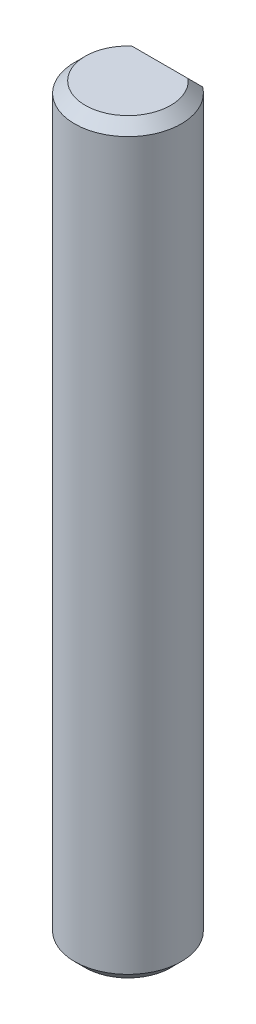
from build123d import *

# Parameters (mm, degrees)
SKETCH1_R           = 2.5
BOSS_EXTRUDE1_DEPTH = 17.5
CUT_EXTRUDE1_START  = -2
SKETCH3_W           = 5.788329994
SKETCH3_H           = 11.481307843
CUT_EXTRUDE1_DEPTH  = 35
CHAMFER1_SIZE       = 0.5


with BuildPart() as part:
    # Sketch1 → Boss-Extrude1 (new, symmetric)
    with BuildSketch(Plane(origin=(0, 0, 0), x_dir=(1, 0, 0), z_dir=(0, 1, 0))):
        with Locations(Location((0, 0, 0), (0, 0, 270))):
            Circle(SKETCH1_R)
    extrude(amount=BOSS_EXTRUDE1_DEPTH, both=True)

    # Sketch3 → Cut-Extrude1 (cut)
    with BuildSketch(Plane.XY.offset(CUT_EXTRUDE1_START)):
        with Locations((0, 13.740653921)):
            Rectangle(SKETCH3_W, SKETCH3_H)
        with Locations((0, -13.740653921)):
            Rectangle(SKETCH3_W, SKETCH3_H)
    extrude(amount=-CUT_EXTRUDE1_DEPTH, mode=Mode.SUBTRACT)

    # Chamfer1
    chamfer1_edges = [part.edges().sort_by_distance(p)[0] for p in [
        (-2.371708245, -17.5, 0.790569415),
        (0, -17.5, -2),
        (-2.371708245, 17.5, 0.790569415),
        (0, 17.5, -2),
    ]]
    chamfer(chamfer1_edges, length=CHAMFER1_SIZE - 0.0001)  # a hair under: the kernel refuses the full size


solid = part.part
